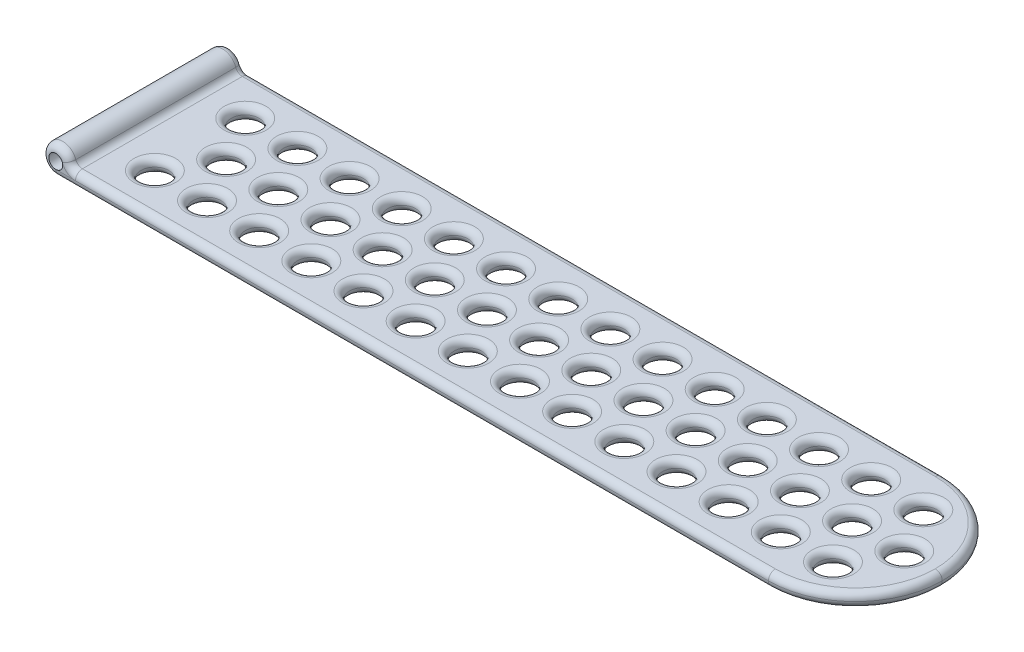
from build123d import *

# Parameters (mm, degrees)
SKETCH1_W           = 115
SKETCH1_H           = 25
BOSS_EXTRUDE1_DEPTH = 2
BOSS_EXTRUDE2_DEPTH = 25
CUT_EXTRUDE8_REACH  = 142.034
FILLET5_R           = 12.5
SKETCH4_R           = 2
CUT_EXTRUDE2_DEPTH  = 139.353047527
FILLET3_R           = 1


with BuildPart() as part:
    # Sketch1 → Boss-Extrude1 (new body)
    with BuildSketch(Plane(origin=(0, 0, 0), x_dir=(1, 0, 0), z_dir=(0, 1, 0))):
        with Locations((80.226416348, -0.5)):
            Rectangle(SKETCH1_W, SKETCH1_H)
    extrude(amount=BOSS_EXTRUDE1_DEPTH)

    # Sketch13 → Boss-Extrude2 (add)
    with BuildSketch(Plane.XY.offset(13)):
        with BuildLine():
            Line((24.726416348, 2), (23.726416348, 2))
            ThreePointArc((23.726416348, 2), (23.433523129, 1.292893219), (22.726416348, 1))
            Line((22.726416348, 1), (22.726416348, 0))
            ThreePointArc((22.726416348, 0), (24.14062991, 0.585786438), (24.726416348, 2))
        make_face()
        with BuildLine():
            ThreePointArc((22.726416348, 1), (22.019309566, 2.707106781), (23.726416348, 2))
            Line((23.726416348, 2), (24.726416348, 2))
            ThreePointArc((24.726416348, 2), (21.312202785, 3.414213562), (22.726416348, 0))
            Line((22.726416348, 0), (22.726416348, 1))
        make_face()
        with BuildLine():
            Line((22.726416348, 2), (23.726416348, 2))
            ThreePointArc((23.726416348, 2), (22.019309566, 2.707106781), (22.726416348, 1))
            Line((22.726416348, 1), (22.726416348, 2))
        make_face()
        with BuildLine():
            ThreePointArc((22.726416348, 1), (23.433523129, 1.292893219), (23.726416348, 2))
            Line((23.726416348, 2), (22.726416348, 2))
            Line((22.726416348, 2), (22.726416348, 1))
        make_face()
    extrude(amount=-BOSS_EXTRUDE2_DEPTH)

    # Sketch13<3> → Cut-Extrude8 (cut, up to next)
    with BuildSketch(Plane.XY.offset(13), mode=Mode.PRIVATE) as cut_extrude8_sk1:
        with BuildLine():
            Line((22.726416348, 2), (23.726416348, 2))
            ThreePointArc((23.726416348, 2), (22.019309566, 2.707106781), (22.726416348, 1))
            Line((22.726416348, 1), (22.726416348, 2))
        make_face()
    cut_extrude8_tool1 = extrude(cut_extrude8_sk1.sketch, amount=-CUT_EXTRUDE8_REACH, mode=Mode.PRIVATE) & part.part
    # Sketch13<3> → Cut-Extrude8 (cut, up to next)
    with BuildSketch(Plane.XY.offset(13), mode=Mode.PRIVATE) as cut_extrude8_sk2:
        with BuildLine():
            ThreePointArc((22.726416348, 1), (23.433523129, 1.292893219), (23.726416348, 2))
            Line((23.726416348, 2), (22.726416348, 2))
            Line((22.726416348, 2), (22.726416348, 1))
        make_face()
    cut_extrude8_tool2 = extrude(cut_extrude8_sk2.sketch, amount=-CUT_EXTRUDE8_REACH, mode=Mode.PRIVATE) & part.part
    # Sketch13<3> → Cut-Extrude8 (cut, up to next)
    with BuildSketch(Plane.XY.offset(13), mode=Mode.PRIVATE) as cut_extrude8_sk3:
        with BuildLine():
            Line((22.726416348, 2), (23.726416348, 2))
            ThreePointArc((23.726416348, 2), (22.019309566, 2.707106781), (22.726416348, 1))
            Line((22.726416348, 1), (22.726416348, 2))
        make_face()
    cut_extrude8_tool3 = extrude(cut_extrude8_sk3.sketch, amount=-CUT_EXTRUDE8_REACH, mode=Mode.PRIVATE) & part.part
    # Sketch13<3> → Cut-Extrude8 (cut, up to next)
    with BuildSketch(Plane.XY.offset(13), mode=Mode.PRIVATE) as cut_extrude8_sk4:
        with BuildLine():
            ThreePointArc((22.726416348, 1), (23.433523129, 1.292893219), (23.726416348, 2))
            Line((23.726416348, 2), (22.726416348, 2))
            Line((22.726416348, 2), (22.726416348, 1))
        make_face()
    cut_extrude8_tool4 = extrude(cut_extrude8_sk4.sketch, amount=-CUT_EXTRUDE8_REACH, mode=Mode.PRIVATE) & part.part
    add(cut_extrude8_tool1.solids().sort_by_distance((22.584945, 2.141471, 13))[0], mode=Mode.SUBTRACT)
    add(cut_extrude8_tool2.solids().sort_by_distance((23.15083, 1.575587, 13))[0], mode=Mode.SUBTRACT)
    add(cut_extrude8_tool3.solids().sort_by_distance((22.584945, 2.141471, 13))[0], mode=Mode.SUBTRACT)
    add(cut_extrude8_tool4.solids().sort_by_distance((23.15083, 1.575587, 13))[0], mode=Mode.SUBTRACT)

    # Fillet5
    fillet5_edges = [part.edges().sort_by_distance(p)[0] for p in [
        (137.726416348, 1, 13),
        (137.726416348, 1, -12),
    ]]
    fillet(fillet5_edges, radius=FILLET5_R - 0.0001)  # a hair under: the kernel refuses the full size

    # Sketch4 → Cut-Extrude2 (cut, through all)
    with BuildSketch(Plane(origin=(0, 2, 0), x_dir=(1, 0, 0), z_dir=(0, 1, 0))):
        with Locations(Location((30.973639598, 6, 0), (0, 0, 270))):
            Circle(SKETCH4_R)
        with Locations(Location((34.726416348, -0.5, 0), (0, 0, 270))):
            Circle(SKETCH4_R)
        with Locations(Location((30.973639598, -7, 0), (0, 0, 270))):
            Circle(SKETCH4_R)
        with Locations(Location((42.229193097, -0.5, 0), (0, 0, 270))):
            Circle(SKETCH4_R)
        with Locations(Location((38.476416348, 6, 0), (0, 0, 270))):
            Circle(SKETCH4_R)
        with Locations(Location((38.476416348, -7, 0), (0, 0, 270))):
            Circle(SKETCH4_R)
        with Locations(Location((49.731969847, -0.5, 0), (0, 0, 270))):
            Circle(SKETCH4_R)
        with Locations(Location((45.979193097, 6, 0), (0, 0, 270))):
            Circle(SKETCH4_R)
        with Locations(Location((45.979193097, -7, 0), (0, 0, 270))):
            Circle(SKETCH4_R)
        with Locations(Location((57.234746597, -0.5, 0), (0, 0, 270))):
            Circle(SKETCH4_R)
        with Locations(Location((53.481969847, 6, 0), (0, 0, 270))):
            Circle(SKETCH4_R)
        with Locations(Location((53.481969847, -7, 0), (0, 0, 270))):
            Circle(SKETCH4_R)
        with Locations(Location((64.737523346, -0.5, 0), (0, 0, 270))):
            Circle(SKETCH4_R)
        with Locations(Location((60.984746597, 6, 0), (0, 0, 270))):
            Circle(SKETCH4_R)
        with Locations(Location((60.984746597, -7, 0), (0, 0, 270))):
            Circle(SKETCH4_R)
        with Locations(Location((72.240300096, -0.5, 0), (0, 0, 270))):
            Circle(SKETCH4_R)
        with Locations(Location((68.487523346, 6, 0), (0, 0, 270))):
            Circle(SKETCH4_R)
        with Locations(Location((68.487523346, -7, 0), (0, 0, 270))):
            Circle(SKETCH4_R)
        with Locations(Location((79.743076846, -0.5, 0), (0, 0, 270))):
            Circle(SKETCH4_R)
        with Locations(Location((75.990300096, 6, 0), (0, 0, 270))):
            Circle(SKETCH4_R)
        with Locations(Location((75.990300096, -7, 0), (0, 0, 270))):
            Circle(SKETCH4_R)
        with Locations(Location((87.245853596, -0.5, 0), (0, 0, 270))):
            Circle(SKETCH4_R)
        with Locations(Location((83.493076846, 6, 0), (0, 0, 270))):
            Circle(SKETCH4_R)
        with Locations(Location((83.493076846, -7, 0), (0, 0, 270))):
            Circle(SKETCH4_R)
        with Locations(Location((94.748630345, -0.5, 0), (0, 0, 270))):
            Circle(SKETCH4_R)
        with Locations(Location((90.995853596, 6, 0), (0, 0, 270))):
            Circle(SKETCH4_R)
        with Locations(Location((90.995853596, -7, 0), (0, 0, 270))):
            Circle(SKETCH4_R)
        with Locations(Location((102.251407095, -0.5, 0), (0, 0, 270))):
            Circle(SKETCH4_R)
        with Locations(Location((98.498630345, 6, 0), (0, 0, 270))):
            Circle(SKETCH4_R)
        with Locations(Location((98.498630345, -7, 0), (0, 0, 270))):
            Circle(SKETCH4_R)
        with Locations(Location((109.754183845, -0.5, 0), (0, 0, 270))):
            Circle(SKETCH4_R)
        with Locations(Location((106.001407095, 6, 0), (0, 0, 270))):
            Circle(SKETCH4_R)
        with Locations(Location((106.001407095, -7, 0), (0, 0, 270))):
            Circle(SKETCH4_R)
        with Locations(Location((117.256960595, -0.5, 0), (0, 0, 270))):
            Circle(SKETCH4_R)
        with Locations(Location((113.504183845, 6, 0), (0, 0, 270))):
            Circle(SKETCH4_R)
        with Locations(Location((113.504183845, -7, 0), (0, 0, 270))):
            Circle(SKETCH4_R)
        with Locations(Location((124.759737344, -0.5, 0), (0, 0, 270))):
            Circle(SKETCH4_R)
        with Locations(Location((121.006960595, 6, 0), (0, 0, 270))):
            Circle(SKETCH4_R)
        with Locations(Location((121.006960595, -7, 0), (0, 0, 270))):
            Circle(SKETCH4_R)
        with Locations(Location((132.262514094, -0.5, 0), (0, 0, 270))):
            Circle(SKETCH4_R)
        with Locations(Location((128.509737344, 6, 0), (0, 0, 270))):
            Circle(SKETCH4_R)
        with Locations(Location((128.509737344, -7, 0), (0, 0, 270))):
            Circle(SKETCH4_R)
    extrude(amount=-CUT_EXTRUDE2_DEPTH, mode=Mode.SUBTRACT)

    # Fillet3
    fillet3_edges = [part.edges().sort_by_distance(p)[0] for p in [
        (73.976466348, 0, 13),
        (73.976466348, 0, -12),
        (30.973639598, 0, -8),
        (113.504183845, 0, 5),
        (117.256960595, 0, -1.5),
        (113.504183845, 0, -8),
        (60.984746597, 0, -8),
        (53.481969847, 0, 5),
        (57.234746597, 0, -1.5),
        (53.481969847, 0, -8),
        (72.240300096, 0, -1.5),
        (68.487523346, 0, -8),
        (60.984746597, 0, 5),
        (64.737523346, 0, -1.5),
        (42.229193097, 0, -1.5),
        (38.476416348, 0, -8),
        (30.973639598, 0, 5),
        (34.726416348, 0, -1.5),
        (45.979193097, 0, 5),
        (49.731969847, 0, -1.5),
        (45.979193097, 0, -8),
        (38.476416348, 0, 5),
        (102.251407095, 0, -1.5),
        (98.498630345, 0, -8),
        (90.995853596, 0, 5),
        (94.748630345, 0, -1.5),
        (106.001407095, 0, 5),
        (109.754183845, 0, -1.5),
        (106.001407095, 0, -8),
        (98.498630345, 0, 5),
        (75.990300096, 0, 5),
        (79.743076846, 0, -1.5),
        (75.990300096, 0, -8),
        (68.487523346, 0, 5),
        (90.995853596, 0, -8),
        (83.493076846, 0, 5),
        (87.245853596, 0, -1.5),
        (83.493076846, 0, -8),
        (74.976466348, 2, 13),
        (74.976466348, 2, -12),
        (30.973639598, 2, -8),
        (113.504183845, 2, 5),
        (117.256960595, 2, -1.5),
        (113.504183845, 2, -8),
        (60.984746597, 2, -8),
        (53.481969847, 2, 5),
        (57.234746597, 2, -1.5),
        (53.481969847, 2, -8),
        (72.240300096, 2, -1.5),
        (68.487523346, 2, -8),
        (60.984746597, 2, 5),
        (64.737523346, 2, -1.5),
        (42.229193097, 2, -1.5),
        (38.476416348, 2, -8),
        (30.973639598, 2, 5),
        (34.726416348, 2, -1.5),
        (45.979193097, 2, 5),
        (49.731969847, 2, -1.5),
        (45.979193097, 2, -8),
        (38.476416348, 2, 5),
        (102.251407095, 2, -1.5),
        (98.498630345, 2, -8),
        (90.995853596, 2, 5),
        (94.748630345, 2, -1.5),
        (106.001407095, 2, 5),
        (109.754183845, 2, -1.5),
        (106.001407095, 2, -8),
        (98.498630345, 2, 5),
        (75.990300096, 2, 5),
        (79.743076846, 2, -1.5),
        (75.990300096, 2, -8),
        (68.487523346, 2, 5),
        (90.995853596, 2, -8),
        (83.493076846, 2, 5),
        (87.245853596, 2, -1.5),
        (83.493076846, 2, -8),
        (128.509737344, 0, -8),
        (128.509737344, 2, -8),
        (132.262514094, 0, -1.5),
        (121.006960595, 0, 5),
        (128.509737344, 0, 5),
        (121.006960595, 0, -8),
        (124.759737344, 0, -1.5),
        (132.262514094, 2, -1.5),
        (121.006960595, 2, 5),
        (128.509737344, 2, 5),
        (121.006960595, 2, -8),
        (124.759737344, 2, -1.5),
        (134.065280402, 0, 9.338864054),
        (134.065280402, 0, -8.338864054),
        (134.065280402, 2, -8.338864054),
        (134.065280402, 2, 9.338864054),
        (21.312202785, 3.414213562, 13),
        (21.312202785, 3.414213562, -12),
        (24.726416348, 2, 0.5),
    ]]
    fillet(fillet3_edges, radius=FILLET3_R - 0.0001)  # a hair under: the kernel refuses the full size


solid = part.part
